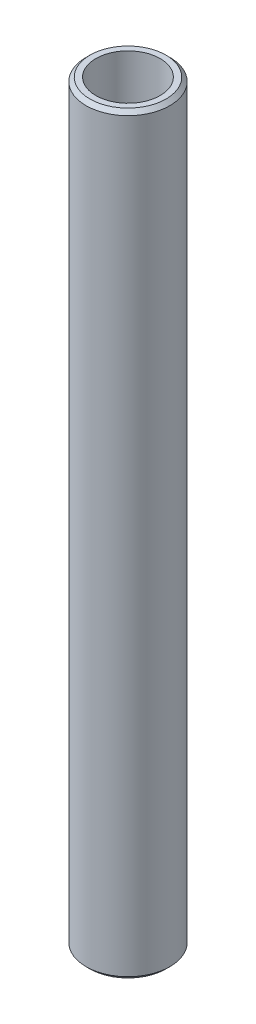
from build123d import *

# Parameters (mm, degrees)
SKETCH1_R           = 30
BOSS_EXTRUDE1_DEPTH = 539.611379546
SKETCH2_R           = 23.010965264
CUT_EXTRUDE1_DEPTH  = 542.276676881
CHAMFER1_SIZE       = 2.753776017


with BuildPart() as part:
    # Sketch1 → Boss-Extrude1 (new body)
    with BuildSketch(Plane(origin=(0, 0, 0), x_dir=(1, 0, 0), z_dir=(0, 1, 0))):
        Circle(SKETCH1_R)
    extrude(amount=BOSS_EXTRUDE1_DEPTH)

    # Sketch2 → Cut-Extrude1 (cut, through all)
    with BuildSketch(Plane(origin=(0, 0, 0), x_dir=(1, 0, 0), z_dir=(0, 1, 0))):
        Circle(SKETCH2_R)
    extrude(amount=CUT_EXTRUDE1_DEPTH, mode=Mode.SUBTRACT)

    # Chamfer1
    chamfer1_edges = [part.edges().sort_by_distance(p)[0] for p in [
        (-30, 539.611379546, 0),
        (-30, 0, 0),
    ]]
    chamfer(chamfer1_edges, length=CHAMFER1_SIZE)


solid = part.part
